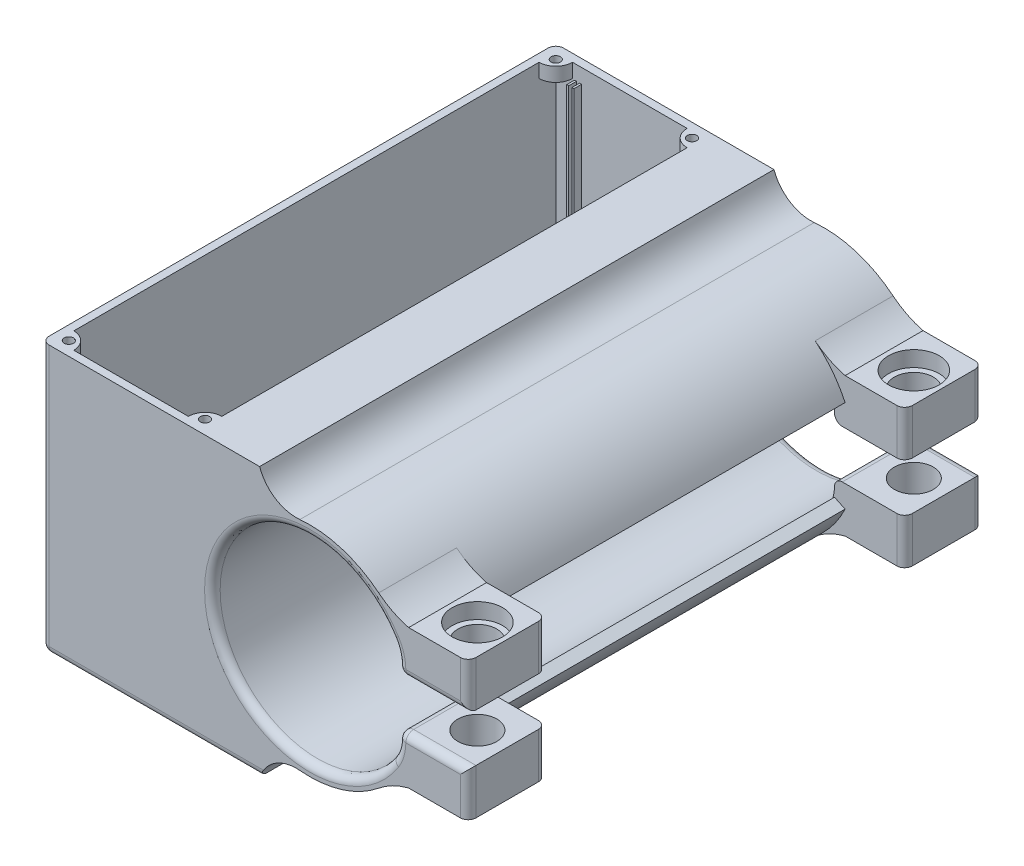
from build123d import *
from build123d.topology import SkipClean

# Parameters (mm, degrees)
CROQUIS1_W               = 21
CROQUIS1_H               = 66.01
CROQUIS1_W_2             = 19
CROQUIS1_H_2             = 64.01
SALIENTE_EXTRUIR1_DEPTH  = 34
CROQUIS4_W               = 21
CROQUIS4_H               = 0.5
SALIENTE_EXTRUIR2_DEPTH  = 66.01
CROQUIS5_W               = 0.25
CROQUIS5_H               = 32.136987358
SALIENTE_EXTRUIR3_DEPTH  = 1
CROQUIS7_W               = 0.25
CROQUIS7_H               = 32.136987358
SALIENTE_EXTRUIR4_DEPTH  = 1
CROQUIS8_R               = 0.6
SALIENTE_EXTRUIR5_DEPTH  = 1.8
CROQUIS13_W              = 66.01
CROQUIS13_H              = 34.5
SALIENTE_EXTRUIR6_DEPTH  = 7
CORTAR_EXTRUIR1_DEPTH    = 80.355655753
SALIENTE_EXTRUIR8_DEPTH  = 66.01
SALIENTE_EXTRUIR9_DEPTH  = 10
SALIENTE_EXTRUIR10_DEPTH = 10
CROQUIS21_W              = 7.640538319
CROQUIS21_H              = 10
SALIENTE_EXTRUIR12_DEPTH = 3
CROQUIS22_W              = 7.640538319
CROQUIS22_H              = 10
SALIENTE_EXTRUIR13_DEPTH = 3
CROQUIS23_R              = 2.5
CORTAR_EXTRUIR2_DEPTH    = 90.673199486
CROQUIS24_R              = 3.25
CORTAR_EXTRUIR3_DEPTH    = 2
CORTAR_EXTRUIR4_START    = -2
CROQUIS26_R              = 3.25
CORTAR_EXTRUIR4_DEPTH    = 2
REDONDEO1_R              = 10
REDONDEO2_R              = 5
REDONDEO3_R              = 5
REDONDEO4_R              = 1
REDONDEO5_R              = 1
REDONDEO6_R              = 1


# Some blends are built 0.0001 mm under size
with BuildPart() as part:
    # Croquis1 → Saliente-Extruir1 (new body)
    with BuildSketch(Plane(origin=(0, 0, 0), x_dir=(1, 0, 0), z_dir=(0, 1, 0))):
        with Locations((10.5, 33.005)):
            Rectangle(CROQUIS1_W, CROQUIS1_H)
        with Locations((10.5, 33.005)):
            Rectangle(CROQUIS1_W_2, CROQUIS1_H_2, mode=Mode.SUBTRACT)
    extrude(amount=SALIENTE_EXTRUIR1_DEPTH)

    # Croquis4 → Saliente-Extruir2 (add)
    with BuildSketch(Plane(origin=(0, 0, -66.01), x_dir=(-1, 0, 0), z_dir=(0, 0, -1))):
        with Locations((-10.5, -0.25)):
            Rectangle(CROQUIS4_W, CROQUIS4_H)
    extrude(amount=-SALIENTE_EXTRUIR2_DEPTH)

    # Croquis5 → Saliente-Extruir3 (add)
    with BuildSketch(Plane(origin=(0, 0, -1), x_dir=(-1, 0, 0), z_dir=(0, 0, -1))):
        with Locations((-3.525, 16.068493679)):
            Rectangle(CROQUIS5_W, CROQUIS5_H)
        with Locations((-4.185, 16.068493679)):
            Rectangle(CROQUIS5_W, CROQUIS5_H)
    extrude(amount=SALIENTE_EXTRUIR3_DEPTH)

    # Croquis7 → Saliente-Extruir4 (add)
    with BuildSketch(Plane.XY.offset(-65.01)):
        with Locations((4.185, 16.068493679)):
            Rectangle(CROQUIS7_W, CROQUIS7_H)
        with Locations((3.525, 16.068493679)):
            Rectangle(CROQUIS7_W, CROQUIS7_H)
    extrude(amount=SALIENTE_EXTRUIR4_DEPTH)

    # Croquis8 → Saliente-Extruir5 (add)
    # profile 1 of 4: a face of its own
    with BuildSketch(Plane(origin=(0, 34, 0), x_dir=(1, 0, 0), z_dir=(0, 1, 0))):
        with BuildLine():
            Line((17.85, 1), (20, 1))
            Line((20, 1), (20, 3.15))
            ThreePointArc((20, 3.15), (18.47972042, 2.52027958), (17.85, 1))
        make_face()
        with Locations(Location((19.23986021, 1.76013979, 0), (0, 0, 270))):
            Circle(CROQUIS8_R, mode=Mode.SUBTRACT)
    # profile 2 of 4: a face of its own
    with BuildSketch(Plane(origin=(0, 34, 0), x_dir=(1, 0, 0), z_dir=(0, 1, 0))):
        with BuildLine():
            Line((3.15, 1), (1, 1))
            Line((1, 1), (1, 3.15))
            ThreePointArc((1, 3.15), (2.52027958, 2.52027958), (3.15, 1))
        make_face()
        with Locations(Location((1.76013979, 1.76013979, 0), (0, 0, 270))):
            Circle(CROQUIS8_R, mode=Mode.SUBTRACT)
    # profile 3 of 4: a face of its own
    with BuildSketch(Plane(origin=(0, 34, 0), x_dir=(1, 0, 0), z_dir=(0, 1, 0))):
        with BuildLine():
            Line((1, 62.86), (1, 65.01))
            Line((1, 65.01), (3.15, 65.01))
            ThreePointArc((3.15, 65.01), (2.52027958, 63.48972042), (1, 62.86))
        make_face()
        with Locations(Location((1.76013979, 64.24986021, 0), (0, 0, 270))):
            Circle(CROQUIS8_R, mode=Mode.SUBTRACT)
    # profile 4 of 4: a face of its own
    with BuildSketch(Plane(origin=(0, 34, 0), x_dir=(1, 0, 0), z_dir=(0, 1, 0))):
        with BuildLine():
            Line((20, 62.86), (20, 65.01))
            Line((20, 65.01), (17.85, 65.01))
            ThreePointArc((17.85, 65.01), (18.47972042, 63.48972042), (20, 62.86))
        make_face()
        with Locations(Location((19.23986021, 64.24986021, 0), (0, 0, 270))):
            Circle(CROQUIS8_R, mode=Mode.SUBTRACT)
    extrude(amount=-SALIENTE_EXTRUIR5_DEPTH)

    # Croquis13 → Saliente-Extruir6 (add)
    with BuildSketch(Plane(origin=(21, 0, 0), x_dir=(0, 0, -1), z_dir=(1, 0, 0))):
        with Locations((33.005, 16.75)):
            Rectangle(CROQUIS13_W, CROQUIS13_H)
    extrude(amount=SALIENTE_EXTRUIR6_DEPTH)

    # Croquis14 → Cortar-Extruir1 (cut, through all)
    with BuildSketch(Plane(origin=(0, 0, -66.01), x_dir=(-1, 0, 0), z_dir=(0, 0, -1))):
        with BuildLine():
            Line((-28, 27.465338279), (-28, 6.034661721))
            ThreePointArc((-28, 6.034661721), (-21.936732522, 16.75), (-28, 27.465338279))
        make_face()
    extrude(amount=-CORTAR_EXTRUIR1_DEPTH, mode=Mode.SUBTRACT)

    # Croquis15 → Saliente-Extruir8 (add, through all)
    with SkipClean():  # the faces are left unmerged after this step: merging them gives an invalid solid
        with BuildSketch(Plane.XY):
            with BuildLine():
                Line((47.125041541, 22.666655664), (45.76557986, 22.032728272))
                ThreePointArc((45.76557986, 22.032728272), (38.092072413, 28.703597378), (28, 27.465338279))
                Line((28, 27.465338279), (28, 29.182557035))
                ThreePointArc((28, 29.182557035), (38.951684885, 30.001988725), (47.125041541, 22.666655664))
            make_face()
            with BuildLine():
                Line((47.125041541, 10.833344336), (45.76557986, 11.467271728))
                ThreePointArc((45.76557986, 11.467271728), (38.092072413, 4.796402622), (28, 6.034661721))
                Line((28, 6.034661721), (28, 4.317442965))
                ThreePointArc((28, 4.317442965), (38.951684885, 3.498011275), (47.125041541, 10.833344336))
            make_face()
        extrude(amount=-SALIENTE_EXTRUIR8_DEPTH)

    # Croquis16 → Saliente-Extruir9 (add)
    with SkipClean():  # the faces are left unmerged after this step: merging them gives an invalid solid
        with BuildSketch(Plane(origin=(0, 0, -66.01), x_dir=(-1, 0, 0), z_dir=(0, 0, -1))):
            Polygon((-45.76557986, 11.467271728), (-45.76557986, 13.667271728), (-54.76557986, 13.667271728), (-54.76557986, 10.833344336), (-47.125041541, 10.833344336), align=None)
            Polygon((-45.76557986, 22.032728272), (-45.76557986, 19.832728272), (-54.76557986, 19.832728272), (-54.76557986, 22.666655664), (-47.125041541, 22.666655664), align=None)
        extrude(amount=-SALIENTE_EXTRUIR9_DEPTH)

    # Croquis17 → Saliente-Extruir10 (add)
    with SkipClean():  # the faces are left unmerged after this step: merging them gives an invalid solid
        with BuildSketch(Plane.XY):
            Polygon((45.76557986, 11.467271728), (47.125041541, 10.833344336), (54.76557986, 10.833344336), (54.76557986, 13.667271728), (45.76557986, 13.667271728), align=None)
            Polygon((47.125041541, 22.666655664), (45.76557986, 22.032728272), (45.76557986, 19.832728272), (54.76557986, 19.832728272), (54.76557986, 22.666655664), align=None)
        extrude(amount=-SALIENTE_EXTRUIR10_DEPTH)

    # Croquis21 → Saliente-Extruir12 (add)
    with SkipClean():  # the faces are left unmerged after this step: merging them gives an invalid solid
        with BuildSketch(Plane(origin=(0, 22.666655664, 0), x_dir=(1, 0, 0), z_dir=(0, 1, 0))):
            with Locations((50.945310701, 61.01)):
                Rectangle(CROQUIS21_W, CROQUIS21_H)
            with Locations((50.945310701, 5)):
                Rectangle(CROQUIS21_W, CROQUIS21_H)
        extrude(amount=SALIENTE_EXTRUIR12_DEPTH)

    # Croquis22 → Saliente-Extruir13 (add)
    with SkipClean():  # the faces are left unmerged after this step: merging them gives an invalid solid
        with BuildSketch(Plane(origin=(0, 10.833344336, 0), x_dir=(-1, 0, 0), z_dir=(0, -1, 0))):
            with Locations((-50.945310701, 5)):
                Rectangle(CROQUIS22_W, CROQUIS22_H)
            with Locations((-50.945310701, 61.01)):
                Rectangle(CROQUIS22_W, CROQUIS22_H)
        extrude(amount=SALIENTE_EXTRUIR13_DEPTH)

    # Croquis23 → Cortar-Extruir2 (cut, through all)
    with SkipClean():  # the faces are left unmerged after this step: merging them gives an invalid solid
        with BuildSketch(Plane(origin=(0, 25.666655664, 0), x_dir=(1, 0, 0), z_dir=(0, 1, 0))):
            with Locations(Location((50.945310701, 61.01, 0), (0, 0, 180))):
                Circle(CROQUIS23_R)
            with Locations(Location((50.945310701, 5, 0), (0, 0, 180))):
                Circle(CROQUIS23_R)
        extrude(amount=-CORTAR_EXTRUIR2_DEPTH, mode=Mode.SUBTRACT)

    # Croquis24 → Cortar-Extruir3 (cut)
    with SkipClean():  # the faces are left unmerged after this step: merging them gives an invalid solid
        with BuildSketch(Plane(origin=(0, 25.666655664, 0), x_dir=(1, 0, 0), z_dir=(0, 1, 0))):
            with Locations(Location((50.945310701, 5, 0), (0, 0, 180))):
                Circle(CROQUIS24_R)
            with Locations(Location((50.945310701, 61.01, 0), (0, 0, 180))):
                Circle(CROQUIS24_R)
        extrude(amount=-CORTAR_EXTRUIR3_DEPTH, mode=Mode.SUBTRACT)

    # Croquis26 → Cortar-Extruir4 (cut)
    with SkipClean():  # the faces are left unmerged after this step: merging them gives an invalid solid
        with BuildSketch(Plane(origin=(0, 7.833344336, 0), x_dir=(-1, 0, 0), z_dir=(0, -1, 0)).offset(CORTAR_EXTRUIR4_START)):
            with Locations((-50.945310701, 61.01)):
                Circle(CROQUIS26_R)
            with Locations((-50.945310701, 5)):
                Circle(CROQUIS26_R)
        extrude(amount=CORTAR_EXTRUIR4_DEPTH, mode=Mode.SUBTRACT)

    # Redondeo1
    # the kernel refuses this fillet: 10 mm, written as the material it adds along each edge
    with BuildSketch(Plane(origin=(47.125041541, 22.666655664, 0), x_dir=(-0.6144931341272565, 0.7889221686012262, 0), z_dir=(0, 0, -1)), Plane(origin=(47.125041541, 22.666655664, -56.01), x_dir=(-0.6144931341272565, 0.7889221686012262, 0), z_dir=(0, 0, -1))) as redondeo1_piece_1:
        with BuildLine():
            CenterArc((8.493265886, 9.74702325), REDONDEO1_R, 232.218641637, 24.866258623)
            Line((2.366766506, 1.843479402), (0, 0))
            ThreePointArc((0, 0), (3.129097958, 0.35416745), (6.258195916, 0))
        make_face()
    extrude(amount=10)
    with BuildSketch(Plane(origin=(47.125041541, 10.833344336, 0), x_dir=(-0.6144931341272596, -0.7889221686012239, 0), z_dir=(0, 0, -1)), Plane(origin=(47.125041541, 10.833344336, -56.01), x_dir=(-0.6144931341272596, -0.7889221686012239, 0), z_dir=(0, 0, -1))) as redondeo1_piece_2:
        with BuildLine():
            CenterArc((8.493265886, -9.74702325), REDONDEO1_R, 102.91509974, 24.866258623)
            Line((2.366766506, -1.843479402), (0, 0))
            ThreePointArc((0, 0), (3.129097958, -0.35416745), (6.258195916, 0))
        make_face()
    extrude(amount=10)

    # Redondeo2
    redondeo2_edges = [part.edges().sort_by_distance(p)[0] for p in [
        (45.76557986, 22.032728272, -61.01),
        (45.76557986, 11.467271728, -61.01),
        (45.76557986, 11.467271728, -5),
        (45.76557986, 22.032728272, -5),
    ]]
    fillet(redondeo2_edges, radius=REDONDEO2_R)

    # Redondeo3
    # the kernel refuses this fillet: 5 mm, written as the material it adds along each edge
    with BuildSketch(Plane(origin=(28, 29.182557035, 0), x_dir=(0, 1, 0), z_dir=(0, 0, -1))) as redondeo3_piece_1:
        with BuildLine():
            CenterArc((6.489027079, 4.712303741), REDONDEO3_R, 174.792703142, 75.676297205)
            Line((1.509662838, 5.166100789), (1.410075553, 5.17517673))
            ThreePointArc((1.410075553, 5.17517673), (0.909439503, 2.537870076), (-0.088803979, 0.045976661))
            Line((-0.088803979, 0.045976661), (0, -0.1))
            ThreePointArc((0, -0.1), (2.408721482, -0.1), (4.784011282, -0.094246075))
            Line((4.784011282, -0.094246075), (4.817442965, 0))
        make_face()
    extrude(amount=66.01)
    with BuildSketch(Plane(origin=(28, 4.317442965, 0), x_dir=(0.9598558660574058, -0.28049370116847083, 0), z_dir=(0, 0, -1))) as redondeo3_piece_2:
        with BuildLine():
            CenterArc((6.343263611, 4.906759189), REDONDEO3_R, 183.241327116, 75.676297205)
            Line((1.351262407, 4.624050889), (1.251422383, 4.618396723))
            ThreePointArc((1.251422383, 4.618396723), (0.579645617, 2.340074815), (-0.095985587, 0.02804937))
            Line((-0.095985587, 0.02804937), (0.019222011, -0.098135184))
            ThreePointArc((0.019222011, -0.098135184), (2.691081532, 0.161074271), (5.362941053, -0.098135184))
            Line((5.362941053, -0.098135184), (5.382163064, 0))
        make_face()
    extrude(amount=66.01)

    # Redondeo4
    redondeo4_edges = [part.edges().sort_by_distance(p)[0] for p in [
        (14, -0.5, 0),
        (0, -0.5, -33.005),
        (14, -0.5, -66.01),
        (0, 16.75, -66.01),
        (0, 16.75, 0),
    ]]
    fillet(redondeo4_edges, radius=REDONDEO4_R)

    # Redondeo5
    redondeo5_edges = [part.edges().sort_by_distance(p)[0] for p in [
        (45.76557986, 13.667271728, -5),
        (45.76557986, 19.832728272, -5),
        (45.76557986, 13.667271728, -61.01),
        (45.76557986, 19.832728272, -61.01),
    ]]
    fillet(redondeo5_edges, radius=REDONDEO5_R)

    # Redondeo6
    redondeo6_edges = [part.edges().sort_by_distance(p)[0] for p in [
        (54.76557986, 10.750308032, -56.01),
        (54.76557986, 10.750308032, -66.01),
        (54.76557986, 22.749691968, -56.01),
        (54.76557986, 22.749691968, -66.01),
        (50.765438036, 19.832728272, -66.01),
        (54.76557986, 10.750308032, -10),
        (54.76557986, 10.750308032, 0),
        (50.765438036, 13.667271728, 0),
        (54.76557986, 22.749691968, -10),
        (54.76557986, 22.749691968, 0),
        (21.936732522, 16.75, -66.01),
        (21.936732522, 16.75, 0),
        (45.559572088, 11.305176888, -66.01),
        (45.559572088, 22.194823112, 0),
        (45.559572088, 11.305176888, 0),
        (50.765438036, 19.832728272, 0),
        (46.061635617, 20.122192019, 0),
        (46.061635617, 13.377807981, 0),
        (45.559572088, 22.194823112, -66.01),
        (50.765438036, 13.667271728, -66.01),
        (46.061635617, 20.122192019, -66.01),
        (46.061635617, 13.377807981, -66.01),
    ]]
    fillet(redondeo6_edges, radius=REDONDEO6_R - 0.0004)  # a hair under: the kernel refuses the full size


solid = part.part
